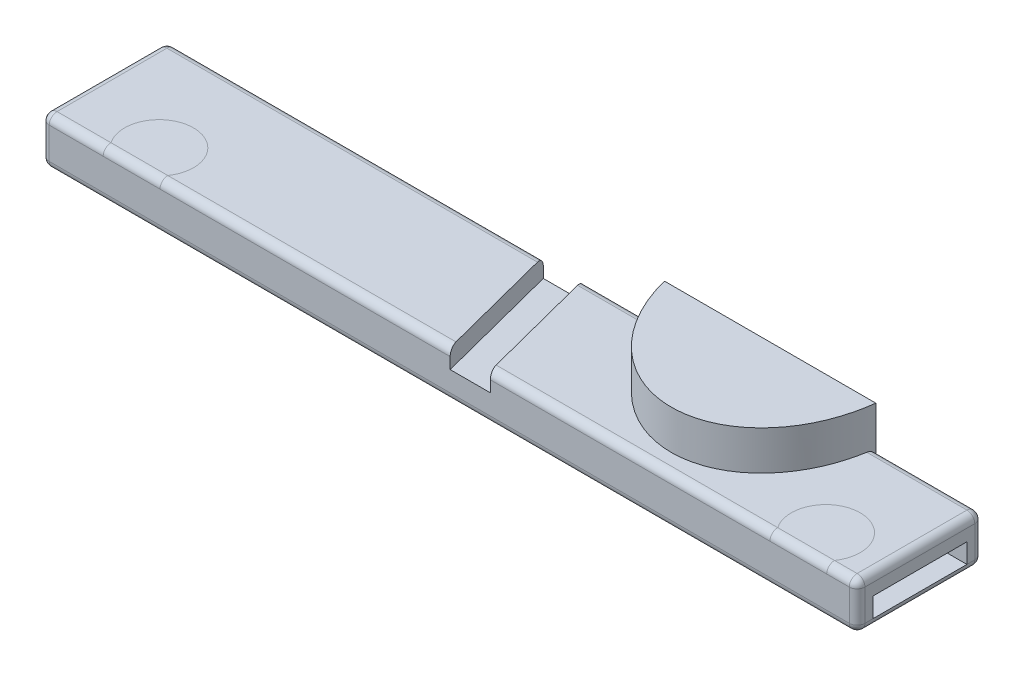
from build123d import *

# Parameters (mm, degrees)
SKETCH1_W               = 279.4
SKETCH1_H               = 63.5
BOSS_EXTRUDE1_DEPTH     = 12.7
BOSS_EXTRUDE2_DEPTH     = 50.8
SKETCH4_W               = 12.586648523787707
SKETCH4_H               = 6.172140988773259
CUT_EXTRUDE1_DEPTH      = 187.15064931818
CUT_EXTRUDE2_DEPTH      = 191.3909441326203
CUT_EXTRUDE2_DEPTH_BACK = 191.3909441326203
SKETCH5_W               = 77.64929915814443
SKETCH5_H               = 50.80000000000001
BOSS_EXTRUDE3_DEPTH     = 12.7
CUT_EXTRUDE4_DEPTH      = 57.15
CUT_EXTRUDE5_DEPTH      = 149.14020610558435
SKETCH23_W              = 260.35
SKETCH23_H              = 63.5
BOSS_EXTRUDE4_DEPTH     = 2.54
CUT_EXTRUDE6_DEPTH      = 149.37954115889764
SKETCH27_W              = 286.4591757611205
SKETCH27_H              = 45.03610752945451
CUT_EXTRUDE7_DEPTH      = 145.07085099474523
SKETCH31_W              = 40.63999999999999
SKETCH31_H              = 15.239999999999998
BOSS_EXTRUDE6_DEPTH     = 3.8099999999999996
CUT_EXTRUDE10_DEPTH     = 38.1
FILLET3_R               = 2.54


with BuildPart() as part:
    # Sketch1 → Boss-Extrude1 (new body)
    with BuildSketch(Plane(origin=(0, 0, 0), x_dir=(1, 0, 0), z_dir=(0, 1, 0))):
        Rectangle(SKETCH1_W, SKETCH1_H)
    extrude(amount=BOSS_EXTRUDE1_DEPTH)

    # Sketch2 → Boss-Extrude2 (add)
    with BuildSketch(Plane(origin=(0, 12.7, 0), x_dir=(1, 0, 0), z_dir=(0, 1, 0))):
        Polygon((-47.69999999999997, -21.749999999999986), (-28.33508326896288, -16.749999999999986), (-44.21008326896288, 44.733610621042764), (-63.57499999999998, 39.73361062104277), align=None)
        Polygon((8.514130017407421, 43.733610621042764), (24.389130017407417, -17.74999999999999), (43.7540467484445, -12.749999999999984), (27.879046748444473, 48.733610621042764), align=None)
    extrude(amount=BOSS_EXTRUDE2_DEPTH)

    # Sketch4 → Cut-Extrude1 (cut, through all)
    with BuildSketch(Plane(origin=(-13.591413263749278, 0, -52.63931722192361), x_dir=(-0.9682458365518543, 0, 0.24999999999999972), z_dir=(-0.24999999999999972, 0, -0.9682458365518543))):
        with Locations((6.706675646106144, 9.613929505613372)):
            Rectangle(SKETCH4_W, SKETCH4_H)
    extrude(amount=-CUT_EXTRUDE1_DEPTH, mode=Mode.SUBTRACT)

    # Sketch5 → Cut-Extrude2 (cut, two sides: drawn at the far end of the back side and taken through both)
    with BuildSketch(Plane(origin=(-30.618670005213612, 0, 7.905706600880859), x_dir=(-0.2500000000000001, 0, -0.9682458365518543), z_dir=(0.9682458365518541, 0, -0.25000000000000006)).offset(-CUT_EXTRUDE2_DEPTH_BACK)):
        with Locations((15.541003475924965, 38.1)):
            Rectangle(SKETCH5_W, SKETCH5_H)
    extrude(amount=CUT_EXTRUDE2_DEPTH + CUT_EXTRUDE2_DEPTH_BACK, mode=Mode.SUBTRACT)

    # Sketch6 → Boss-Extrude3 (add)
    with BuildSketch(Plane(origin=(0, 12.7, 0), x_dir=(1, 0, 0), z_dir=(0, 1, 0))):
        with BuildLine():
            Line((16.77527777661138, 35.78638852333846), (85.61472706482589, 47.625000000000014))
            add(Edge.make_bspline(
                [(16.77527777661138, 35.78638852333846), (24.308939625396, -8.020533750979865), (58.728664269503255, -2.101228012649095), (93.14838891361052, 3.8180777256816754), (85.61472706482589, 47.625000000000014)],
                knots=[4.71238898038469, 4.71238898038469, 4.71238898038469, 6.283185307179586, 6.283185307179586, 7.853981633974483, 7.853981633974483, 7.853981633974483], degree=2, weights=[1, 0.7071067811865476, 1, 0.7071067811865476, 1]))
        make_face()
    extrude(amount=BOSS_EXTRUDE3_DEPTH)

    # Sketch17 → Cut-Extrude4 (cut)
    with BuildSketch(Plane(origin=(139.70000000000002, 0, 0), x_dir=(0, 0, -1), z_dir=(1, 0, 0))):
        Polygon((26.670000000000012, -1.52e-15), (-3.80999999999998, -5.2e-15), (-3.80999999999998, 6.349999999999993), (26.670000000000012, 6.349999999999996), align=None)
    extrude(amount=-CUT_EXTRUDE4_DEPTH, mode=Mode.SUBTRACT)

    # Sketch22 → Cut-Extrude5 (cut, through all)
    with BuildSketch(Plane(origin=(0, 12.7, 0), x_dir=(1, 0, 0), z_dir=(0, 1, 0))):
        Polygon((139.70000000000002, -32.204899371851745), (120.65000000000002, -32.204899371851745), (120.65000000000002, 31.750000000000014), (139.70000000000005, 31.750000000000014), align=None)
    extrude(amount=-CUT_EXTRUDE5_DEPTH, mode=Mode.SUBTRACT)

    # Sketch23 → Boss-Extrude4 (add)
    with BuildSketch(Plane.XZ):
        with Locations((-9.524999999999963, -1.421e-14)):
            Rectangle(SKETCH23_W, SKETCH23_H)
    extrude(amount=BOSS_EXTRUDE4_DEPTH)

    # Sketch25 → Cut-Extrude6 (cut, through all)
    with BuildSketch(Plane.XZ.offset(-12.7)):
        with BuildLine():
            Line((86.05470968261828, -31.750000000000014), (17.622098670079023, -31.750000000000014))
            add(Edge.make_bspline(
                [(17.622098670079023, -31.750000000000014), (17.12530185096651, -33.75105992388856), (16.77527777661137, -35.78638852333846)],
                knots=[1.4779404098519116, 1.4779404098519116, 1.4779404098519116, 1.5707963267948968, 1.5707963267948968, 1.5707963267948968], degree=2, weights=[1, 0.9989224159229568, 1]))
            Line((16.77527777661137, -35.78638852333846), (85.6147270648259, -47.62500000000003))
            add(Edge.make_bspline(
                [(85.6147270648259, -47.62500000000003), (86.99136168467464, -39.620111142189245), (86.05470968261828, -31.750000000000014)],
                knots=[4.71238898038469, 4.71238898038469, 4.71238898038469, 5.073863183068598, 5.073863183068598, 5.073863183068598], degree=2, weights=[1, 0.9837114625910768, 1]))
        make_face()
    extrude(amount=-CUT_EXTRUDE6_DEPTH, mode=Mode.SUBTRACT)

    # Sketch27 → Cut-Extrude7 (cut, through all)
    with BuildSketch(Plane(origin=(0, 12.7, 0), x_dir=(1, 0, 0), z_dir=(0, 1, 0))):
        with Locations((-9.278901051751589, -31.408053764727235)):
            Rectangle(SKETCH27_W, SKETCH27_H)
    extrude(amount=-CUT_EXTRUDE7_DEPTH, mode=Mode.SUBTRACT)

    # Sketch31 → Boss-Extrude6 (add)
    with BuildSketch(Plane.ZY.offset(139.69999999999996)):
        with Locations((-11.430000000000017, 5.079999999999998)):
            Rectangle(SKETCH31_W, SKETCH31_H)
    extrude(amount=BOSS_EXTRUDE6_DEPTH)

    # Sketch32 → Cut-Extrude10 (cut)
    with BuildSketch(Plane.ZY.offset(143.50999999999996)):
        Polygon((-26.67000000000002, 6.35), (3.80999999999998, 6.35), (3.809999999999981, 0), (-26.67000000000002, 0), align=None)
    extrude(amount=-CUT_EXTRUDE10_DEPTH, mode=Mode.SUBTRACT)

    # Fillet3
    fillet3_edges = [part.edges().sort_by_distance(p)[0] for p in [
        (61.259240327968, 12.7, 8.889999999999981),
        (-77.32047702099145, 12.7, 8.889999999999983),
        (120.65000000000002, -2.54, -11.430000000000021),
        (-143.50999999999996, 5.079999999999999, 8.889999999999981),
        (-143.50999999999996, 5.08, -31.750000000000014),
        (120.65000000000002, 5.079999999999999, -31.750000000000014),
        (120.65000000000002, 5.08, 8.88999999999998),
        (-11.429999999999964, -2.54, -31.750000000000014),
        (-11.429999999999964, -2.54, 8.88999999999998),
        (-143.50999999999996, -2.54, -11.430000000000017),
        (120.65000000000002, 12.7, -11.430000000000014),
        (103.35235484130929, 12.7, -31.750000000000014),
        (4.49868822334534, 12.7, -31.750000000000014),
        (-143.50999999999996, 12.7, -11.430000000000016),
        (-82.56707846065376, 12.7, -31.750000000000014),
    ]]
    fillet(fillet3_edges, radius=FILLET3_R - 0.0001)  # a hair under: the kernel refuses the full size


solid = part.part
